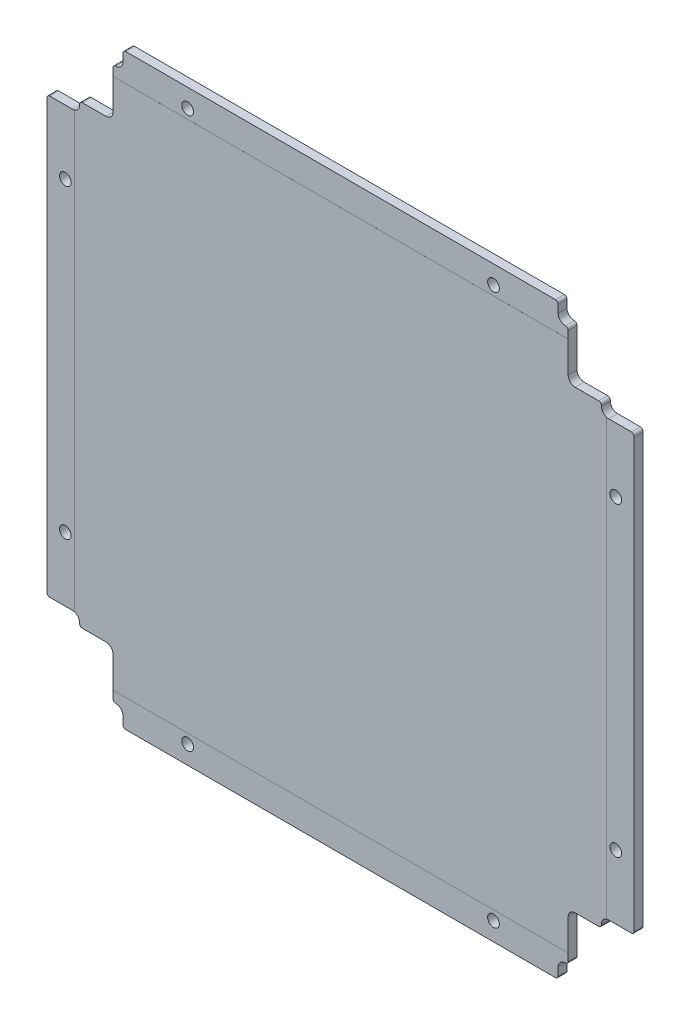
from build123d import *

# Parameters (mm, degrees)
SKETCH1_W                 = 106
SKETCH1_H                 = 106
MAINOUTLINE_DEPTH         = 1.6
SKETCH4_W                 = 11.7
SKETCH4_H                 = 11.7
RAILCUTOUTS_DEPTH         = 75.970394157
SKETCH13_W                = 5.7
SKETCH13_H                = 1.9
SKETCH13_W_2              = 1.8
SKETCH13_H_2              = 3
FILLETCUTOUTS_DEPTH       = 75.970394157
SMOOTHCORNER_DEPTH        = 10
MIRROR2_COPY_1_SKETCH_W   = 11.7
MIRROR2_COPY_1_SKETCH_H   = 11.7
MIRROR2_COPY_1_DEPTH      = 75.970394157
MIRROR2_COPY_2_SKETCH_W   = 5.7
MIRROR2_COPY_2_SKETCH_H   = 1.9
MIRROR2_COPY_2_SKETCH_W_2 = 1.8
MIRROR2_COPY_2_SKETCH_H_2 = 3
MIRROR2_COPY_2_DEPTH      = 75.970394157
MIRROR2_COPY_3_DEPTH      = 10
MIRROR2_COPY_4_SKETCH_W   = 11.7
MIRROR2_COPY_4_SKETCH_H   = 11.7
MIRROR2_COPY_4_DEPTH      = 75.970394157
MIRROR2_COPY_5_SKETCH_W   = 5.7
MIRROR2_COPY_5_SKETCH_H   = 1.9
MIRROR2_COPY_5_SKETCH_W_2 = 1.8
MIRROR2_COPY_5_SKETCH_H_2 = 3
MIRROR2_COPY_5_DEPTH      = 75.970394157
MIRROR2_COPY_6_DEPTH      = 10
FILLET10_R                = 0.5
M2_CLEARANCE_HOLE1_D      = 2.1
SKETCH16_W                = 90
SKETCH16_H                = 5.2
SKETCH16_W_2              = 5.2
SKETCH16_H_2              = 90
CUT_EXTRUDE6_DEPTH        = 0.001
SKETCH24_OUTSIDE_W        = 137.984
SKETCH24_OUTSIDE_H        = 137.984
SKETCH24_OUTSIDE_W_2      = 105.6
SKETCH24_OUTSIDE_H_2      = 105.6
CUT_EXTRUDE19_DEPTH       = 75.970394157
FILLET7_R                 = 0.5


with BuildPart() as part:
    # Sketch1 → mainOutline (new body)
    with BuildSketch(Plane.XY):
        Rectangle(SKETCH1_W, SKETCH1_H)
    extrude(amount=MAINOUTLINE_DEPTH)

    # Sketch4 → railCutouts (cut, through all)
    with BuildSketch(Plane(origin=(0, 0, 0), x_dir=(-1, 0, 0), z_dir=(0, 0, -1))):
        with Locations((47.15, 47.15)):
            Rectangle(SKETCH4_W, SKETCH4_H)
    railcutouts = extrude(amount=-RAILCUTOUTS_DEPTH, mode=Mode.SUBTRACT)

    # Sketch13 → filletCutouts (cut, symmetric)
    with BuildSketch(Plane(origin=(0, 0, 0), x_dir=(-1, 0, 0), z_dir=(0, 0, -1))):
        with Locations((50.15, 40.35)):
            Rectangle(SKETCH13_W, SKETCH13_H)
        with Locations((40.4, 51.5)):
            Rectangle(SKETCH13_W_2, SKETCH13_H_2)
    filletcutouts = extrude(amount=FILLETCUTOUTS_DEPTH, both=True, mode=Mode.SUBTRACT)

    # Sketch27 → smoothCorner (cut)
    with BuildSketch(Plane.XY.offset(1.6)):
        with BuildLine():
            Line((-40.928025612, 42.198025612), (-40.928025612, 49.628025612))
            Line((-40.928025612, 49.628025612), (-40.398025612, 49.628025612))
            ThreePointArc((-40.398025612, 49.628025612), (-39.5, 50), (-39.128025612, 50.898025612))
            Line((-39.128025612, 50.898025612), (-39.128025612, 53))
            Line((-39.128025612, 53), (-53, 53))
            Line((-53, 53), (-53, 39.028025612))
            Line((-53, 39.028025612), (-48.198025612, 39.028025612))
            ThreePointArc((-48.198025612, 39.028025612), (-47.3, 39.4), (-46.928025612, 40.298025612))
            Line((-46.928025612, 40.298025612), (-46.928025612, 40.928025612))
            Line((-46.928025612, 40.928025612), (-42.198025612, 40.928025612))
            ThreePointArc((-42.198025612, 40.928025612), (-41.3, 41.3), (-40.928025612, 42.198025612))
        make_face()
    smoothcorner = extrude(amount=-SMOOTHCORNER_DEPTH, mode=Mode.SUBTRACT)

    # Mirror1: railCutouts, filletCutouts, smoothCorner across plane
    add(railcutouts.mirror(Plane(origin=(0, 0, 0), x_dir=(0, 0, 1), z_dir=(1, 0, 0))), mode=Mode.SUBTRACT)
    add(filletcutouts.mirror(Plane(origin=(0, 0, 0), x_dir=(0, 0, 1), z_dir=(1, 0, 0))), mode=Mode.SUBTRACT)
    add(smoothcorner.mirror(Plane(origin=(0, 0, 0), x_dir=(0, 0, 1), z_dir=(1, 0, 0))), mode=Mode.SUBTRACT)

    # Mirror2 copy 1 sketch → Mirror2 copy 1 (cut, through all)
    with BuildSketch(Plane(origin=(0, 0, 0), x_dir=(1, 0, 0), z_dir=(0, 0, -1))):
        with Locations((47.15, 47.15)):
            Rectangle(MIRROR2_COPY_1_SKETCH_W, MIRROR2_COPY_1_SKETCH_H)
    extrude(amount=-MIRROR2_COPY_1_DEPTH, mode=Mode.SUBTRACT)

    # Mirror2 copy 2 sketch → Mirror2 copy 2 (cut, symmetric)
    with BuildSketch(Plane(origin=(0, 0, 0), x_dir=(1, 0, 0), z_dir=(0, 0, -1))):
        with Locations((50.15, 40.35)):
            Rectangle(MIRROR2_COPY_2_SKETCH_W, MIRROR2_COPY_2_SKETCH_H)
        with Locations((40.4, 51.5)):
            Rectangle(MIRROR2_COPY_2_SKETCH_W_2, MIRROR2_COPY_2_SKETCH_H_2)
    extrude(amount=MIRROR2_COPY_2_DEPTH, both=True, mode=Mode.SUBTRACT)

    # Mirror2 copy 3 sketch → Mirror2 copy 3 (cut)
    with BuildSketch(Plane(origin=(0, 0, 1.6), x_dir=(-1, 0, 0), z_dir=(0, 0, 1))):
        with BuildLine():
            Line((-40.928025612, 42.198025612), (-40.928025612, 49.628025612))
            Line((-40.928025612, 49.628025612), (-40.398025612, 49.628025612))
            ThreePointArc((-40.398025612, 49.628025612), (-39.5, 50), (-39.128025612, 50.898025612))
            Line((-39.128025612, 50.898025612), (-39.128025612, 53))
            Line((-39.128025612, 53), (-53, 53))
            Line((-53, 53), (-53, 39.028025612))
            Line((-53, 39.028025612), (-48.198025612, 39.028025612))
            ThreePointArc((-48.198025612, 39.028025612), (-47.3, 39.4), (-46.928025612, 40.298025612))
            Line((-46.928025612, 40.298025612), (-46.928025612, 40.928025612))
            Line((-46.928025612, 40.928025612), (-42.198025612, 40.928025612))
            ThreePointArc((-42.198025612, 40.928025612), (-41.3, 41.3), (-40.928025612, 42.198025612))
        make_face()
    extrude(amount=-MIRROR2_COPY_3_DEPTH, mode=Mode.SUBTRACT)

    # Mirror2 copy 4 sketch → Mirror2 copy 4 (cut, through all)
    with BuildSketch(Plane(origin=(0, 0, 0), x_dir=(-1, 0, 0), z_dir=(0, 0, -1))):
        with Locations((47.15, -47.15)):
            Rectangle(MIRROR2_COPY_4_SKETCH_W, MIRROR2_COPY_4_SKETCH_H)
    extrude(amount=-MIRROR2_COPY_4_DEPTH, mode=Mode.SUBTRACT)

    # Mirror2 copy 5 sketch → Mirror2 copy 5 (cut, symmetric)
    with BuildSketch(Plane(origin=(0, 0, 0), x_dir=(-1, 0, 0), z_dir=(0, 0, -1))):
        with Locations((50.15, -40.35)):
            Rectangle(MIRROR2_COPY_5_SKETCH_W, MIRROR2_COPY_5_SKETCH_H)
        with Locations((40.4, -51.5)):
            Rectangle(MIRROR2_COPY_5_SKETCH_W_2, MIRROR2_COPY_5_SKETCH_H_2)
    extrude(amount=MIRROR2_COPY_5_DEPTH, both=True, mode=Mode.SUBTRACT)

    # Mirror2 copy 6 sketch → Mirror2 copy 6 (cut)
    with BuildSketch(Plane.XY.offset(1.6)):
        with BuildLine():
            Line((-40.928025612, -42.198025612), (-40.928025612, -49.628025612))
            Line((-40.928025612, -49.628025612), (-40.398025612, -49.628025612))
            ThreePointArc((-40.398025612, -49.628025612), (-39.5, -50), (-39.128025612, -50.898025612))
            Line((-39.128025612, -50.898025612), (-39.128025612, -53))
            Line((-39.128025612, -53), (-53, -53))
            Line((-53, -53), (-53, -39.028025612))
            Line((-53, -39.028025612), (-48.198025612, -39.028025612))
            ThreePointArc((-48.198025612, -39.028025612), (-47.3, -39.4), (-46.928025612, -40.298025612))
            Line((-46.928025612, -40.298025612), (-46.928025612, -40.928025612))
            Line((-46.928025612, -40.928025612), (-42.198025612, -40.928025612))
            ThreePointArc((-42.198025612, -40.928025612), (-41.3, -41.3), (-40.928025612, -42.198025612))
        make_face()
    extrude(amount=-MIRROR2_COPY_6_DEPTH, mode=Mode.SUBTRACT)

    # Fillet10
    fillet10_edges = [part.edges().sort_by_distance(p)[0] for p in [
        (46.928025612, -40.928025612, 0.8),
        (40.928025612, -49.628025612, 0.8),
        (40.928025612, 49.628025612, 0.8),
        (46.928025612, 40.928025612, 0.8),
        (-46.928025612, 40.928025612, 0.8),
        (-40.928025612, 49.628025612, 0.8),
        (-46.928025612, -40.928025612, 0.8),
        (-40.928025612, -49.628025612, 0.8),
    ]]
    fillet(fillet10_edges, radius=FILLET10_R)

    # M2 Clearance Hole1 (through all)
    with Locations(Plane(origin=(0, 0, 0), x_dir=(-1, 0, 0), z_dir=(0, 0, -1))):
        with Locations((49.5, -27.5), (27.5, -49.5), (-49.5, -27.5), (-27.5, -49.5), (-27.5, 49.5), (-49.5, 27.5), (27.5, 49.5), (49.5, 27.5)):
            Hole(M2_CLEARANCE_HOLE1_D / 2)

    # Sketch16 → Cut-Extrude6 (cut)
    with BuildSketch(Plane.XY.offset(1.6)):
        with Locations((0, -50.4)):
            Rectangle(SKETCH16_W, SKETCH16_H)
        with Locations((0, 50.4)):
            Rectangle(SKETCH16_W, SKETCH16_H)
        with Locations((-50.4, 0)):
            Rectangle(SKETCH16_W_2, SKETCH16_H_2)
        with Locations((50.4, 0)):
            Rectangle(SKETCH16_W_2, SKETCH16_H_2)
    extrude(amount=-CUT_EXTRUDE6_DEPTH, mode=Mode.SUBTRACT)

    # Sketch24 outside → Cut-Extrude19 (cut, through all)
    with BuildSketch(Plane.XY.offset(1.6)):
        Rectangle(SKETCH24_OUTSIDE_W, SKETCH24_OUTSIDE_H)
        Rectangle(SKETCH24_OUTSIDE_W_2, SKETCH24_OUTSIDE_H_2, mode=Mode.SUBTRACT)
    extrude(amount=-CUT_EXTRUDE19_DEPTH, mode=Mode.SUBTRACT)

    # Fillet7
    fillet7_edges = [part.edges().sort_by_distance(p)[0] for p in [
        (-52.8, -39.028025612, 0.7995),
        (-39.128025612, -52.8, 0.7995),
        (39.128025612, -52.8, 0.7995),
        (52.8, -39.028025612, 0.7995),
        (52.8, 39.028025612, 0.7995),
        (39.128025612, 52.8, 0.7995),
        (-39.128025612, 52.8, 0.7995),
        (-52.8, 39.028025612, 0.7995),
    ]]
    fillet(fillet7_edges, radius=FILLET7_R)


solid = part.part
